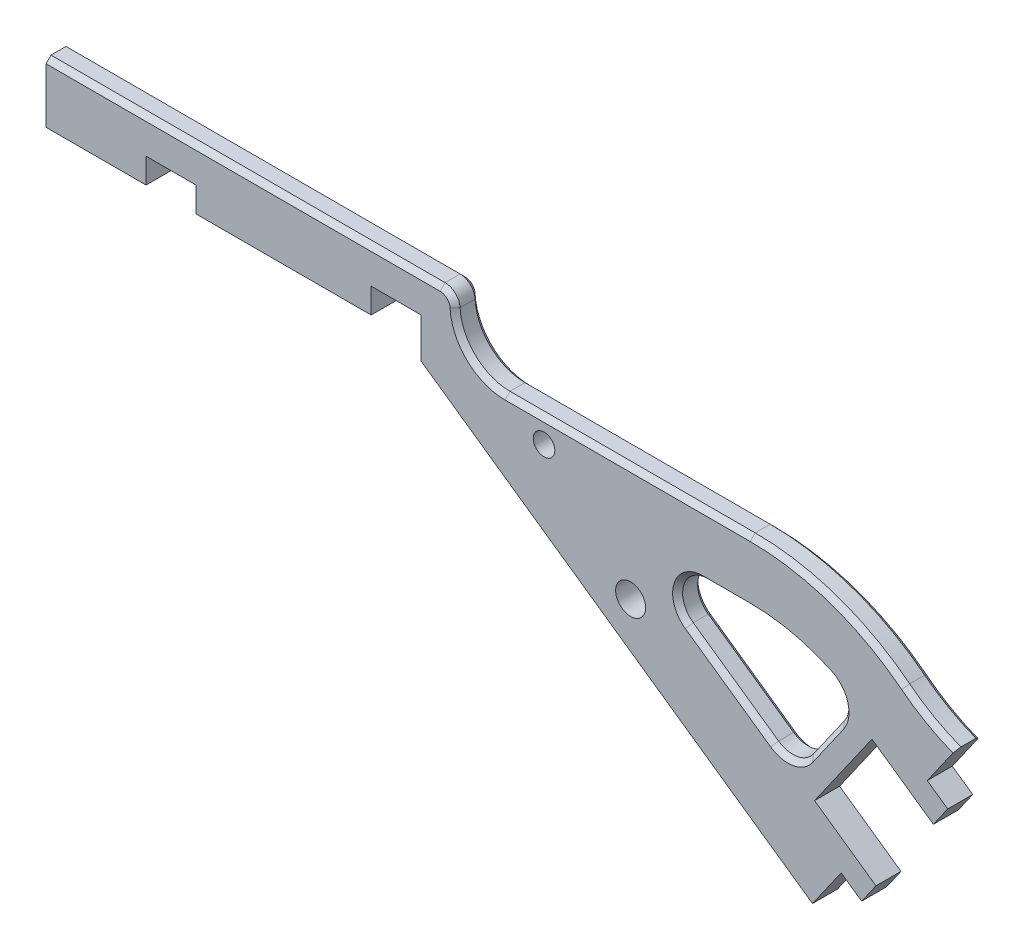
from build123d import *

# Parameters (mm, degrees)
BOSS_EXTRUDE1_DEPTH = 5
CHAMFER1_SIZE       = 1
SKETCH2_R           = 2.153029852
CUT_EXTRUDE1_DEPTH  = 201.095166995


with BuildPart() as part:
    # Sketch1 → Boss-Extrude1 (new body)
    with BuildSketch(Plane.XY):
        with BuildLine():
            Line((3.22, -6), (3.22, -18))
            Line((3.22, -18), (20, -18))
            Line((20, -18), (23.22, -18))
            Line((23.22, -18), (23.22, -13))
            Line((23.22, -13), (30, -13))
            Line((30, -13), (33.22, -13))
            Line((33.22, -13), (33.22, -18))
            Line((33.22, -18), (65, -18))
            Line((65, -18), (68.22, -18))
            Line((68.22, -18), (68.22, -13))
            Line((68.22, -13), (78.216414533, -13))
            Line((78.216414533, -13), (78.216414533, -21))
            Line((78.216414533, -21), (156.445434763, -75.776549672))
            Line((156.445434763, -75.776549672), (162.181199127, -67.585029229))
            Line((162.181199127, -67.585029229), (166.276959348, -70.45291141))
            Line((166.276959348, -70.45291141), (169.14484153, -66.357151189))
            Line((169.14484153, -66.357151189), (156.857560865, -57.753504644))
            Line((156.857560865, -57.753504644), (168.329089592, -41.370463758))
            Line((168.329089592, -41.370463758), (180.616370257, -49.974110303))
            Line((180.616370257, -49.974110303), (183.484252439, -45.878350082))
            Line((183.484252439, -45.878350082), (179.388492217, -43.0104679))
            Line((179.388492217, -43.0104679), (185.124256581, -34.818947457))
            ThreePointArc((185.124256581, -34.818947457), (179.787433064, -32.30663188), (174.889010548, -29.02046821))
            ThreePointArc((174.889010548, -29.02046821), (160.335002276, -21.073869092), (143.982422158, -18.324193149))
            Line((143.982422158, -18.324193149), (94.982422158, -18.324193149))
            ThreePointArc((94.982422158, -18.324193149), (88.097602416, -15.57672768), (84.995943575, -8.844044573))
            ThreePointArc((84.995943575, -8.844044573), (84.065445923, -6.824239641), (82, -6))
            Line((82, -6), (3.22, -6))
        make_face()
        with BuildLine():
            ThreePointArc((117.09, -41.25), (120.09, -38.25), (123.09, -41.25))
            ThreePointArc((123.09, -41.25), (120.09, -44.25), (117.09, -41.25))
        make_face(mode=Mode.SUBTRACT)
        with BuildLine():
            ThreePointArc((155.629682826, -50.78986224), (152.402163493, -52.846018824), (148.666040423, -52.01774028))
            Line((148.666040423, -52.01774028), (131.614539977, -40.07815113))
            ThreePointArc((131.614539977, -40.07815113), (129.713837405, -34.478861911), (134.482422158, -30.982390909))
            Line((134.482422158, -30.982390909), (143.982422158, -30.982390909))
            ThreePointArc((143.982422158, -30.982390909), (152.121697345, -31.880230769), (159.86957387, -34.530575334))
            ThreePointArc((159.86957387, -34.530575334), (162.57396085, -37.768942598), (161.838073119, -41.923362018))
            Line((161.838073119, -41.923362018), (155.629682826, -50.78986224))
        make_face(mode=Mode.SUBTRACT)
    extrude(amount=BOSS_EXTRUDE1_DEPTH)

    # Chamfer1
    chamfer1_edges = [part.edges().sort_by_distance(p)[0] for p in [
        (162.57396085, -37.768942598, 0),
        (152.121697345, -31.880230769, 0),
        (158.733877972, -46.356612129, 0),
        (139.232422158, -30.982390909, 0),
        (152.402163493, -52.846018824, 0),
        (129.713837405, -34.478861911, 0),
        (140.1402902, -46.047945705, 0),
        (158.733877972, -46.356612129, 5),
        (162.57396085, -37.768942598, 5),
        (152.402163493, -52.846018824, 5),
        (152.121697345, -31.880230769, 5),
        (140.1402902, -46.047945705, 5),
        (139.232422158, -30.982390909, 5),
        (129.713837405, -34.478861911, 5),
        (179.787433064, -32.30663188, 0),
        (160.335002276, -21.073869092, 0),
        (119.482422158, -18.324193149, 0),
        (88.097602416, -15.57672768, 0),
        (84.065445923, -6.824239641, 0),
        (42.61, -6, 0),
        (179.787433064, -32.30663188, 5),
        (160.335002276, -21.073869092, 5),
        (119.482422158, -18.324193149, 5),
        (88.097602416, -15.57672768, 5),
        (84.065445923, -6.824239641, 5),
        (42.61, -6, 5),
    ]]
    chamfer(chamfer1_edges, length=CHAMFER1_SIZE)

    # Sketch2 → Cut-Extrude1 (cut, through all)
    with BuildSketch(Plane(origin=(0, 0, 0), x_dir=(-1, 0, 0), z_dir=(0, 0, -1))):
        with Locations((-102.782398289, -23.115064163)):
            Circle(SKETCH2_R)
    extrude(amount=-CUT_EXTRUDE1_DEPTH, mode=Mode.SUBTRACT)


solid = part.part
